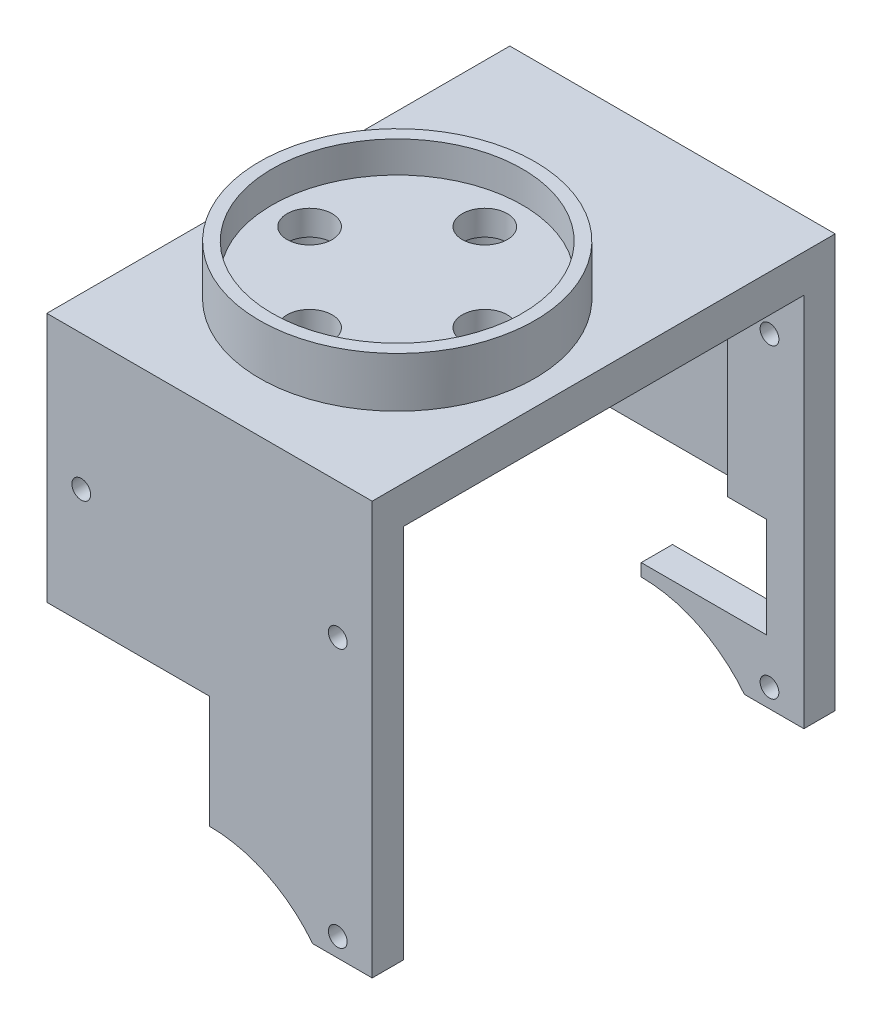
from build123d import *

# Parameters (mm, degrees)
SKETCH_1_W                      = 26
SKETCH_1_H                      = 33
EXTRUDE_1_DEPTH                 = 37
SKETCH_3_W                      = 26
SKETCH_3_H                      = 32
CUT_EXTRUDE_1_DEPTH             = 30
CUT_EXTRUDE_2_REACH             = 57.982
SKETCH_2_R                      = 0.75
CUT_EXTRUDE_2_DIRECTION_2_DEPTH = 56.982140009
CUT_EXTRUDE_3_REACH             = 57.982
SKETCH_4_R                      = 0.75
SKETCH_5_W                      = 17
SKETCH_5_H                      = 1.5
CUT_EXTRUDE_4_DEPTH             = 27
CUT_EXTRUDE_5_REACH             = 57.982
SKETCH_6_W                      = 20
SKETCH_6_H                      = 8
CUT_EXTRUDE_START               = -37
CUT_EXTRUDE_6_OUTLINE_R         = 0.75
CUT_EXTRUDE_6_DEPTH             = 37
SKETCH_8_W                      = 15
SKETCH_8_H                      = 1.5
CUT_EXTRUDE_7_DEPTH             = 13
SKETCH_9_R                      = 11
SKETCH_9_R_2                    = 10
EXTRUDE_2_DEPTH                 = 4
SKETCH_12_R                     = 10
EXTRUDE_3_DEPTH                 = 1.5
CUT_EXTRUDE_8_DEPTH             = 56.982140009
CUT_EXTRUDE_8_DEPTH_BACK        = 56.982140009
SKETCH_10_R                     = 1.8
SKETCH_11_R                     = 2.8
CUT_EXTRUDE_9_DEPTH             = 2.5


# Read off the part's stored shape, not the designer's step: 切除-拉伸6
with BuildPart() as part:
    # 草图1 → 凸台-拉伸1 (new body)
    with BuildSketch(Plane.XY):
        with Locations((13, 16.5)):
            Rectangle(SKETCH_1_W, SKETCH_1_H)
    extrude(amount=EXTRUDE_1_DEPTH)

    # 草图3 → 切除-拉伸1 (cut)
    with BuildSketch(Plane.XZ):
        with Locations((13, 18.5)):
            Rectangle(SKETCH_3_W, SKETCH_3_H)
    extrude(amount=-CUT_EXTRUDE_1_DEPTH, mode=Mode.SUBTRACT)

    # 草图2 → 切除-拉伸2 (cut, up to next)
    with BuildSketch(Plane.XY.offset(37), mode=Mode.PRIVATE) as cut_extrude_2_sk1:
        with Locations(Location((2.75, 1.5, 0), (0, 0, 180))):
            Circle(SKETCH_2_R)
    cut_extrude_2_tool1 = extrude(cut_extrude_2_sk1.sketch, amount=-CUT_EXTRUDE_2_REACH, mode=Mode.PRIVATE) & part.part
    # 草图2 → 切除-拉伸2 (cut, up to next)
    with BuildSketch(Plane.XY.offset(37), mode=Mode.PRIVATE) as cut_extrude_2_sk2:
        with Locations(Location((23.25, 1.5, 0), (0, 0, 180))):
            Circle(SKETCH_2_R)
    cut_extrude_2_tool2 = extrude(cut_extrude_2_sk2.sketch, amount=-CUT_EXTRUDE_2_REACH, mode=Mode.PRIVATE) & part.part
    # 草图2 → 切除-拉伸2 (cut, up to next)
    with BuildSketch(Plane.XY.offset(37), mode=Mode.PRIVATE) as cut_extrude_2_sk3:
        with Locations(Location((23.25, 22.2, 0), (0, 0, 180))):
            Circle(SKETCH_2_R)
    cut_extrude_2_tool3 = extrude(cut_extrude_2_sk3.sketch, amount=-CUT_EXTRUDE_2_REACH, mode=Mode.PRIVATE) & part.part
    # 草图2 → 切除-拉伸2 (cut, up to next)
    with BuildSketch(Plane.XY.offset(37), mode=Mode.PRIVATE) as cut_extrude_2_sk4:
        with Locations(Location((2.75, 22.2, 0), (0, 0, 180))):
            Circle(SKETCH_2_R)
    cut_extrude_2_tool4 = extrude(cut_extrude_2_sk4.sketch, amount=-CUT_EXTRUDE_2_REACH, mode=Mode.PRIVATE) & part.part
    add(cut_extrude_2_tool1.solids().sort_by_distance((2.75, 1.5, 37))[0], mode=Mode.SUBTRACT)
    add(cut_extrude_2_tool2.solids().sort_by_distance((23.25, 1.5, 37))[0], mode=Mode.SUBTRACT)
    add(cut_extrude_2_tool3.solids().sort_by_distance((23.25, 22.2, 37))[0], mode=Mode.SUBTRACT)
    add(cut_extrude_2_tool4.solids().sort_by_distance((2.75, 22.2, 37))[0], mode=Mode.SUBTRACT)

    # 草图2 → 切除-拉伸2 direction 2 (cut)
    with BuildSketch(Plane.XY.offset(37)):
        with Locations(Location((2.75, 1.5, 0), (0, 0, 180))):
            Circle(SKETCH_2_R)
        with Locations(Location((23.25, 1.5, 0), (0, 0, 180))):
            Circle(SKETCH_2_R)
        with Locations(Location((23.25, 22.2, 0), (0, 0, 180))):
            Circle(SKETCH_2_R)
        with Locations(Location((2.75, 22.2, 0), (0, 0, 180))):
            Circle(SKETCH_2_R)
    extrude(amount=CUT_EXTRUDE_2_DIRECTION_2_DEPTH, mode=Mode.SUBTRACT)

    # 草图4 → 切除-拉伸3 (cut, up to next)
    with BuildSketch(Plane(origin=(0, 0, 0), x_dir=(-1, 0, 0), z_dir=(0, 0, -1)), mode=Mode.PRIVATE) as cut_extrude_3_sk1:
        with Locations((-2.75, 1.5)):
            Circle(SKETCH_4_R)
    cut_extrude_3_tool1 = extrude(cut_extrude_3_sk1.sketch, amount=-CUT_EXTRUDE_3_REACH, mode=Mode.PRIVATE) & part.part
    # 草图4 → 切除-拉伸3 (cut, up to next)
    with BuildSketch(Plane(origin=(0, 0, 0), x_dir=(-1, 0, 0), z_dir=(0, 0, -1)), mode=Mode.PRIVATE) as cut_extrude_3_sk2:
        with Locations((-23.25, 1.5)):
            Circle(SKETCH_4_R)
    cut_extrude_3_tool2 = extrude(cut_extrude_3_sk2.sketch, amount=-CUT_EXTRUDE_3_REACH, mode=Mode.PRIVATE) & part.part
    # 草图4 → 切除-拉伸3 (cut, up to next)
    with BuildSketch(Plane(origin=(0, 0, 0), x_dir=(-1, 0, 0), z_dir=(0, 0, -1)), mode=Mode.PRIVATE) as cut_extrude_3_sk3:
        with Locations((-23.25, 25.95)):
            Circle(SKETCH_4_R)
    cut_extrude_3_tool3 = extrude(cut_extrude_3_sk3.sketch, amount=-CUT_EXTRUDE_3_REACH, mode=Mode.PRIVATE) & part.part
    # 草图4 → 切除-拉伸3 (cut, up to next)
    with BuildSketch(Plane(origin=(0, 0, 0), x_dir=(-1, 0, 0), z_dir=(0, 0, -1)), mode=Mode.PRIVATE) as cut_extrude_3_sk4:
        with Locations((-3.25, 25.95)):
            Circle(SKETCH_4_R)
    cut_extrude_3_tool4 = extrude(cut_extrude_3_sk4.sketch, amount=-CUT_EXTRUDE_3_REACH, mode=Mode.PRIVATE) & part.part
    add(cut_extrude_3_tool1.solids().sort_by_distance((2.75, 1.5, 0))[0], mode=Mode.SUBTRACT)
    add(cut_extrude_3_tool2.solids().sort_by_distance((23.25, 1.5, 0))[0], mode=Mode.SUBTRACT)
    add(cut_extrude_3_tool3.solids().sort_by_distance((23.25, 25.95, 0))[0], mode=Mode.SUBTRACT)
    add(cut_extrude_3_tool4.solids().sort_by_distance((3.25, 25.95, 0))[0], mode=Mode.SUBTRACT)

    # 草图5 → 切除-拉伸4 (cut)
    with BuildSketch(Plane.XZ):
        with Locations((13, 35.25)):
            Rectangle(SKETCH_5_W, SKETCH_5_H)
    extrude(amount=-CUT_EXTRUDE_4_DEPTH, mode=Mode.SUBTRACT)

    # 草图6 → 切除-拉伸5 (cut, up to next)
    with BuildSketch(Plane(origin=(0, 0, 0), x_dir=(-1, 0, 0), z_dir=(0, 0, -1)), mode=Mode.PRIVATE) as cut_extrude_5_sk1:
        with Locations((-13, 9)):
            Rectangle(SKETCH_6_W, SKETCH_6_H)
    cut_extrude_5_tool1 = extrude(cut_extrude_5_sk1.sketch, amount=-CUT_EXTRUDE_5_REACH, mode=Mode.PRIVATE) & part.part
    add(cut_extrude_5_tool1.solids().sort_by_distance((13, 9, 0))[0], mode=Mode.SUBTRACT)

    # 切除-拉伸6 outline → 切除-拉伸6 (cut)
    with BuildSketch(Plane(origin=(0, 0, 0), x_dir=(-1, 0, 0), z_dir=(0, 0, -1)).offset(CUT_EXTRUDE_START)):
        with BuildLine():
            Line((0, 0), (0, 13))
            Line((0, 13), (-13, 13))
            Line((-13, 13), (-13, 4))
            ThreePointArc((-13, 4), (-17.582575695, 2.947221814), (-21.246211251, 0))
            Line((-21.246211251, 0), (0, 0))
        make_face()
        with Locations((-2.75, 1.5)):
            Circle(CUT_EXTRUDE_6_OUTLINE_R, mode=Mode.SUBTRACT)
    extrude(amount=CUT_EXTRUDE_6_DEPTH, mode=Mode.SUBTRACT)

    # 草图8 → 切除-拉伸7 (cut)
    with BuildSketch(Plane.XZ.offset(-13)):
        with Locations((12.397702636, 1.75)):
            Rectangle(SKETCH_8_W, SKETCH_8_H)
    extrude(amount=-CUT_EXTRUDE_7_DEPTH, mode=Mode.SUBTRACT)

    # 草图9 → 凸台-拉伸2 (add)
    with BuildSketch(Plane(origin=(0, 33, 0), x_dir=(1, 0, 0), z_dir=(0, 1, 0))):
        with Locations(Location((13, -22, 0), (0, 0, 90))):
            Circle(SKETCH_9_R)
        with Locations(Location((13, -22, 0), (0, 0, 270))):
            Circle(SKETCH_9_R_2, mode=Mode.SUBTRACT)
    extrude(amount=EXTRUDE_2_DEPTH)

    # 草图12 → 凸台-拉伸3 (add)
    with BuildSketch(Plane(origin=(0, 33, 0), x_dir=(1, 0, 0), z_dir=(0, 1, 0))):
        with Locations(Location((13, -22, 0), (0, 0, 270))):
            Circle(SKETCH_12_R)
    extrude(amount=EXTRUDE_3_DEPTH)

    # 草图10 → 切除-拉伸8 (cut, two sides: drawn at the far end of the back side and taken through both)
    with BuildSketch(Plane(origin=(0, 33, 0), x_dir=(1, 0, 0), z_dir=(0, 1, 0)).offset(-CUT_EXTRUDE_8_DEPTH_BACK)):
        with Locations(Location((13, -15, 0), (0, 0, 270))):
            Circle(SKETCH_10_R)
        with Locations(Location((20, -22, 0), (0, 0, 270))):
            Circle(SKETCH_10_R)
        with Locations(Location((13, -29, 0), (0, 0, 270))):
            Circle(SKETCH_10_R)
        with Locations(Location((6, -22, 0), (0, 0, 270))):
            Circle(SKETCH_10_R)
    extrude(amount=CUT_EXTRUDE_8_DEPTH + CUT_EXTRUDE_8_DEPTH_BACK, mode=Mode.SUBTRACT)

    # 草图11 → 切除-拉伸9 (cut)
    with BuildSketch(Plane.XZ.offset(-30)):
        with Locations(Location((6, 22, 0), (0, 0, 270))):
            Circle(SKETCH_11_R)
        with Locations(Location((13, 29, 0), (0, 0, 270))):
            Circle(SKETCH_11_R)
        with Locations(Location((20, 22, 0), (0, 0, 270))):
            Circle(SKETCH_11_R)
        with Locations(Location((13, 15, 0), (0, 0, 270))):
            Circle(SKETCH_11_R)
    extrude(amount=-CUT_EXTRUDE_9_DEPTH, mode=Mode.SUBTRACT)


solid = part.part
